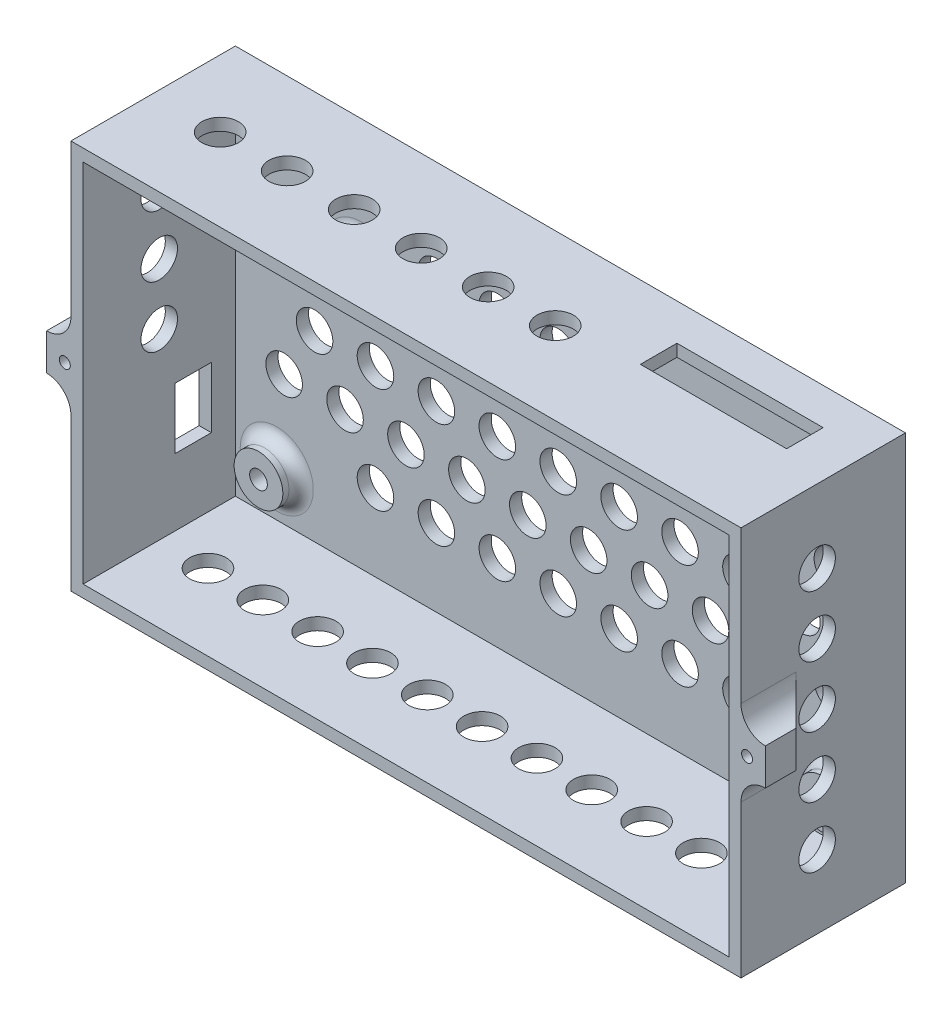
from build123d import *

# Parameters (mm, degrees)
SKETCH_1_W          = 110
SKETCH_1_H          = 64
EXTRUDE_1_DEPTH     = 2
SKETCH_2_W          = 110
SKETCH_2_H          = 64
SKETCH_2_W_2        = 106
SKETCH_2_H_2        = 60
EXTRUDE_2_DEPTH     = 25
SKETCH_3_R          = 4
EXTRUDE_3_DEPTH     = 3
SKETCH_4_R          = 1.45
CUT_EXTRUDE_1_DEPTH = 10
FILLET_1_R          = 2
SKETCH_5_W          = 24
SKETCH_5_H          = 6
CUT_EXTRUDE_2_DEPTH = 10
SKETCH_6_W          = 6
SKETCH_6_H          = 10
CUT_EXTRUDE_3_DEPTH = 10
SKETCH_7_W          = 4
SKETCH_7_H          = 6
EXTRUDE_4_DEPTH     = 5
CHAMFER_1_SIZE      = 4
SKETCH_8_R          = 0.9
CUT_EXTRUDE_4_DEPTH = 5
SKETCH_9_R          = 3
CUT_EXTRUDE_5_DEPTH = 2
OTHER_1_OUTLINE_R   = 3
OTHER_1_DEPTH       = 2
SKETCH_10_R         = 3
CUT_EXTRUDE_6_DEPTH = 2
OTHER_START         = 62
OTHER_2_OUTLINE_R   = 3
OTHER_2_DEPTH       = 2
SKETCH_11_R         = 3
CUT_EXTRUDE_7_DEPTH = 2
OTHER_3_OUTLINE_R   = 3
OTHER_3_DEPTH       = 2
SKETCH_12_R         = 3
CUT_EXTRUDE_8_DEPTH = 2
OTHER_4_OUTLINE_R   = 3
OTHER_4_DEPTH       = 2
CUT_EXTRUDE_START   = -2
SKETCH_13_R         = 3
CUT_EXTRUDE_9_DEPTH = 2
OTHER_START_2       = 108
OTHER_5_OUTLINE_R   = 3
OTHER_5_DEPTH       = 2
FILLET_2_R          = 4


with BuildPart() as part:
    # 草图1 → 凸台-拉伸1 (new body)
    with BuildSketch(Plane.XY):
        with Locations((55, 32)):
            Rectangle(SKETCH_1_W, SKETCH_1_H)
    extrude(amount=EXTRUDE_1_DEPTH)

    # 草图2 → 凸台-拉伸2 (add)
    with BuildSketch(Plane.XY.offset(2)):
        with Locations((55, 32)):
            Rectangle(SKETCH_2_W, SKETCH_2_H)
        with Locations((55, 32)):
            Rectangle(SKETCH_2_W_2, SKETCH_2_H_2, mode=Mode.SUBTRACT)
    extrude(amount=EXTRUDE_2_DEPTH)

    # 草图3 → 凸台-拉伸3 (add)
    with BuildSketch(Plane.XY.offset(2)):
        with Locations(Location((22.635418977, 45.334342238, 0), (0, 0, 180))):
            Circle(SKETCH_3_R)
        with Locations(Location((8.792391291, 9.266270102, 0), (0, 0, 180))):
            Circle(SKETCH_3_R)
        with Locations(Location((101.248576203, 9.393270356, 0), (0, 0, 180))):
            Circle(SKETCH_3_R)
    extrude(amount=EXTRUDE_3_DEPTH)

    # 草图4 → 切除-拉伸1 (cut)
    with BuildSketch(Plane.XY.offset(5)):
        with Locations((22.635418977, 45.334342238)):
            Circle(SKETCH_4_R)
        with Locations((8.792391291, 9.266270102)):
            Circle(SKETCH_4_R)
        with Locations((101.248576203, 9.393270356)):
            Circle(SKETCH_4_R)
    extrude(amount=-CUT_EXTRUDE_1_DEPTH, mode=Mode.SUBTRACT)

    # 圆角1
    fillet_1_edges = [part.edges().sort_by_distance(p)[0] for p in [
        (105.248576203, 9.393270356, 2),
        (12.792391291, 9.266270102, 2),
        (26.635418977, 45.334342238, 2),
    ]]
    fillet(fillet_1_edges, radius=FILLET_1_R)

    # 草图5 → 切除-拉伸2 (cut)
    with BuildSketch(Plane(origin=(0, 62, 0), x_dir=(-1, 0, 0), z_dir=(0, -1, 0))):
        with Locations((-90.5, -9.012523577)):
            Rectangle(SKETCH_5_W, SKETCH_5_H)
    extrude(amount=-CUT_EXTRUDE_2_DEPTH, mode=Mode.SUBTRACT)

    # 草图6 → 切除-拉伸3 (cut)
    with BuildSketch(Plane(origin=(2, 0, 0), x_dir=(0, 0, -1), z_dir=(1, 0, 0))):
        with Locations((-8.94288238, 18)):
            Rectangle(SKETCH_6_W, SKETCH_6_H)
    extrude(amount=-CUT_EXTRUDE_3_DEPTH, mode=Mode.SUBTRACT)

    # 草图7 → 凸台-拉伸4 (add)
    with BuildSketch(Plane.XY.offset(27)):
        with Locations((-2, 32)):
            Rectangle(SKETCH_7_W, SKETCH_7_H)
        with Locations((112, 32)):
            Rectangle(SKETCH_7_W, SKETCH_7_H)
    extrude(amount=-EXTRUDE_4_DEPTH)

    # 倒角1
    chamfer_1_edges = [part.edges().sort_by_distance(p)[0] for p in [
        (110, 32, 22),
        (0, 32, 22),
    ]]
    chamfer(chamfer_1_edges, length=CHAMFER_1_SIZE - 0.0001)  # a hair under: the kernel refuses the full size

    # 草图8 → 切除-拉伸4 (cut)
    with BuildSketch(Plane.XY.offset(27)):
        with Locations((-1, 32)):
            Circle(SKETCH_8_R)
        with Locations((111, 32)):
            Circle(SKETCH_8_R)
    extrude(amount=-CUT_EXTRUDE_4_DEPTH, mode=Mode.SUBTRACT)

    # 草图9 → 切除-拉伸5 (cut)
    with BuildSketch(Plane.XY.offset(2)):
        with Locations((55, 32)):
            Circle(SKETCH_9_R)
    extrude(amount=-CUT_EXTRUDE_5_DEPTH, mode=Mode.SUBTRACT)

    # 填充阵列1: read off the stored shape, not the designer's step
    # 填充阵列1 outline → 填充阵列1 (cut)
    with BuildSketch(Plane.XY):
        with Locations((10, 40.660254038)):
            Circle(OTHER_1_OUTLINE_R)
        with Locations((90, 40.660254038)):
            Circle(OTHER_1_OUTLINE_R)
        with Locations((95, 49.320508076)):
            Circle(OTHER_1_OUTLINE_R)
        with Locations((85, 14.679491924)):
            Circle(OTHER_1_OUTLINE_R)
        with Locations((90, 23.339745962)):
            Circle(OTHER_1_OUTLINE_R)
        with Locations((95, 32)):
            Circle(OTHER_1_OUTLINE_R)
        with Locations((100, 40.660254038)):
            Circle(OTHER_1_OUTLINE_R)
        with Locations((100, 23.339745962)):
            Circle(OTHER_1_OUTLINE_R)
        with Locations((40, 40.660254038)):
            Circle(OTHER_1_OUTLINE_R)
        with Locations((45, 49.320508076)):
            Circle(OTHER_1_OUTLINE_R)
        with Locations((35, 14.679491924)):
            Circle(OTHER_1_OUTLINE_R)
        with Locations((40, 23.339745962)):
            Circle(OTHER_1_OUTLINE_R)
        with Locations((45, 14.679491924)):
            Circle(OTHER_1_OUTLINE_R)
        with Locations((55, 49.320508076)):
            Circle(OTHER_1_OUTLINE_R)
        with Locations((50, 40.660254038)):
            Circle(OTHER_1_OUTLINE_R)
        with Locations((45, 32)):
            Circle(OTHER_1_OUTLINE_R)
        with Locations((25, 32)):
            Circle(OTHER_1_OUTLINE_R)
        with Locations((20, 23.339745962)):
            Circle(OTHER_1_OUTLINE_R)
        with Locations((15, 32)):
            Circle(OTHER_1_OUTLINE_R)
        with Locations((10, 23.339745962)):
            Circle(OTHER_1_OUTLINE_R)
        with Locations((35, 32)):
            Circle(OTHER_1_OUTLINE_R)
        with Locations((30, 23.339745962)):
            Circle(OTHER_1_OUTLINE_R)
        with Locations((25, 14.679491924)):
            Circle(OTHER_1_OUTLINE_R)
        with Locations((35, 49.320508076)):
            Circle(OTHER_1_OUTLINE_R)
        with Locations((65, 14.679491924)):
            Circle(OTHER_1_OUTLINE_R)
        with Locations((70, 23.339745962)):
            Circle(OTHER_1_OUTLINE_R)
        with Locations((75, 32)):
            Circle(OTHER_1_OUTLINE_R)
        with Locations((80, 40.660254038)):
            Circle(OTHER_1_OUTLINE_R)
        with Locations((85, 32)):
            Circle(OTHER_1_OUTLINE_R)
        with Locations((80, 23.339745962)):
            Circle(OTHER_1_OUTLINE_R)
        with Locations((75, 14.679491924)):
            Circle(OTHER_1_OUTLINE_R)
        with Locations((85, 49.320508076)):
            Circle(OTHER_1_OUTLINE_R)
        with Locations((55, 14.679491924)):
            Circle(OTHER_1_OUTLINE_R)
        with Locations((65, 49.320508076)):
            Circle(OTHER_1_OUTLINE_R)
        with Locations((60, 40.660254038)):
            Circle(OTHER_1_OUTLINE_R)
        with Locations((50, 23.339745962)):
            Circle(OTHER_1_OUTLINE_R)
        with Locations((60, 23.339745962)):
            Circle(OTHER_1_OUTLINE_R)
        with Locations((65, 32)):
            Circle(OTHER_1_OUTLINE_R)
        with Locations((70, 40.660254038)):
            Circle(OTHER_1_OUTLINE_R)
        with Locations((75, 49.320508076)):
            Circle(OTHER_1_OUTLINE_R)
    extrude(amount=OTHER_1_DEPTH, mode=Mode.SUBTRACT)

    # 草图10 → 切除-拉伸6 (cut)
    with BuildSketch(Plane(origin=(0, 64, 0), x_dir=(1, 0, 0), z_dir=(0, 1, 0))):
        with Locations(Location((55, -13.5, 0), (0, 0, 270))):
            Circle(SKETCH_10_R)
    extrude(amount=-CUT_EXTRUDE_6_DEPTH, mode=Mode.SUBTRACT)

    # 填充阵列2: read off the stored shape, not the designer's step
    # 填充阵列2 outline → 填充阵列2 (cut)
    with BuildSketch(Plane(origin=(0, 0, 0), x_dir=(1, 0, 0), z_dir=(0, 1, 0)).offset(OTHER_START)):
        with Locations((11, -13.5)):
            Circle(OTHER_2_OUTLINE_R)
        with Locations((22, -13.5)):
            Circle(OTHER_2_OUTLINE_R)
        with Locations((33, -13.5)):
            Circle(OTHER_2_OUTLINE_R)
        with Locations((44, -13.5)):
            Circle(OTHER_2_OUTLINE_R)
        with Locations((66, -13.5)):
            Circle(OTHER_2_OUTLINE_R)
    extrude(amount=OTHER_2_DEPTH, mode=Mode.SUBTRACT)

    # 草图11 → 切除-拉伸7 (cut)
    with BuildSketch(Plane(origin=(0, 2, 0), x_dir=(1, 0, 0), z_dir=(0, 1, 0))):
        with Locations(Location((55, -14.5, 0), (0, 0, 270))):
            Circle(SKETCH_11_R)
    extrude(amount=-CUT_EXTRUDE_7_DEPTH, mode=Mode.SUBTRACT)

    # 填充阵列3: read off the stored shape, not the designer's step
    # 填充阵列3 outline → 填充阵列3 (cut)
    with BuildSketch(Plane(origin=(0, 0, 0), x_dir=(1, 0, 0), z_dir=(0, 1, 0))):
        with Locations((100, -14.5)):
            Circle(OTHER_3_OUTLINE_R)
        with Locations((91, -14.5)):
            Circle(OTHER_3_OUTLINE_R)
        with Locations((82, -14.5)):
            Circle(OTHER_3_OUTLINE_R)
        with Locations((73, -14.5)):
            Circle(OTHER_3_OUTLINE_R)
        with Locations((64, -14.5)):
            Circle(OTHER_3_OUTLINE_R)
        with Locations((46, -14.5)):
            Circle(OTHER_3_OUTLINE_R)
        with Locations((37, -14.5)):
            Circle(OTHER_3_OUTLINE_R)
        with Locations((28, -14.5)):
            Circle(OTHER_3_OUTLINE_R)
        with Locations((19, -14.5)):
            Circle(OTHER_3_OUTLINE_R)
        with Locations((10, -14.5)):
            Circle(OTHER_3_OUTLINE_R)
    extrude(amount=OTHER_3_DEPTH, mode=Mode.SUBTRACT)

    # 草图12 → 切除-拉伸8 (cut)
    with BuildSketch(Plane(origin=(2, 0, 0), x_dir=(0, 0, -1), z_dir=(1, 0, 0))):
        with Locations((-14.5, 32)):
            Circle(SKETCH_12_R)
    extrude(amount=-CUT_EXTRUDE_8_DEPTH, mode=Mode.SUBTRACT)

    # 填充阵列4: read off the stored shape, not the designer's step
    # 填充阵列4 outline → 填充阵列4 (cut)
    with BuildSketch(Plane.YZ):
        with Locations((42, 14.5)):
            Circle(OTHER_4_OUTLINE_R)
        with Locations((52, 14.5)):
            Circle(OTHER_4_OUTLINE_R)
    extrude(amount=OTHER_4_DEPTH, mode=Mode.SUBTRACT)

    # 草图13 → 切除-拉伸9 (cut)
    with BuildSketch(Plane.ZY.offset(-108).offset(CUT_EXTRUDE_START)):
        with Locations(Location((14.5, 32, 0), (0, 0, 180))):
            Circle(SKETCH_13_R)
    extrude(amount=CUT_EXTRUDE_9_DEPTH, mode=Mode.SUBTRACT)

    # 填充阵列5: read off the stored shape, not the designer's step
    # 填充阵列5 outline → 填充阵列5 (cut)
    with BuildSketch(Plane.YZ.offset(OTHER_START_2)):
        with Locations((42, 14.5)):
            Circle(OTHER_5_OUTLINE_R)
        with Locations((52, 14.5)):
            Circle(OTHER_5_OUTLINE_R)
        with Locations((22, 14.5)):
            Circle(OTHER_5_OUTLINE_R)
        with Locations((12, 14.5)):
            Circle(OTHER_5_OUTLINE_R)
    extrude(amount=OTHER_5_DEPTH, mode=Mode.SUBTRACT)

    # 圆角2
    fillet_2_edges = [part.edges().sort_by_distance(p)[0] for p in [
        (110, 35, 22.50005),
        (110, 29, 22.50005),
        (0, 35, 22.50005),
        (0, 29, 22.50005),
    ]]
    fillet(fillet_2_edges, radius=FILLET_2_R - 0.0001)  # a hair under: the kernel refuses the full size


solid = part.part
